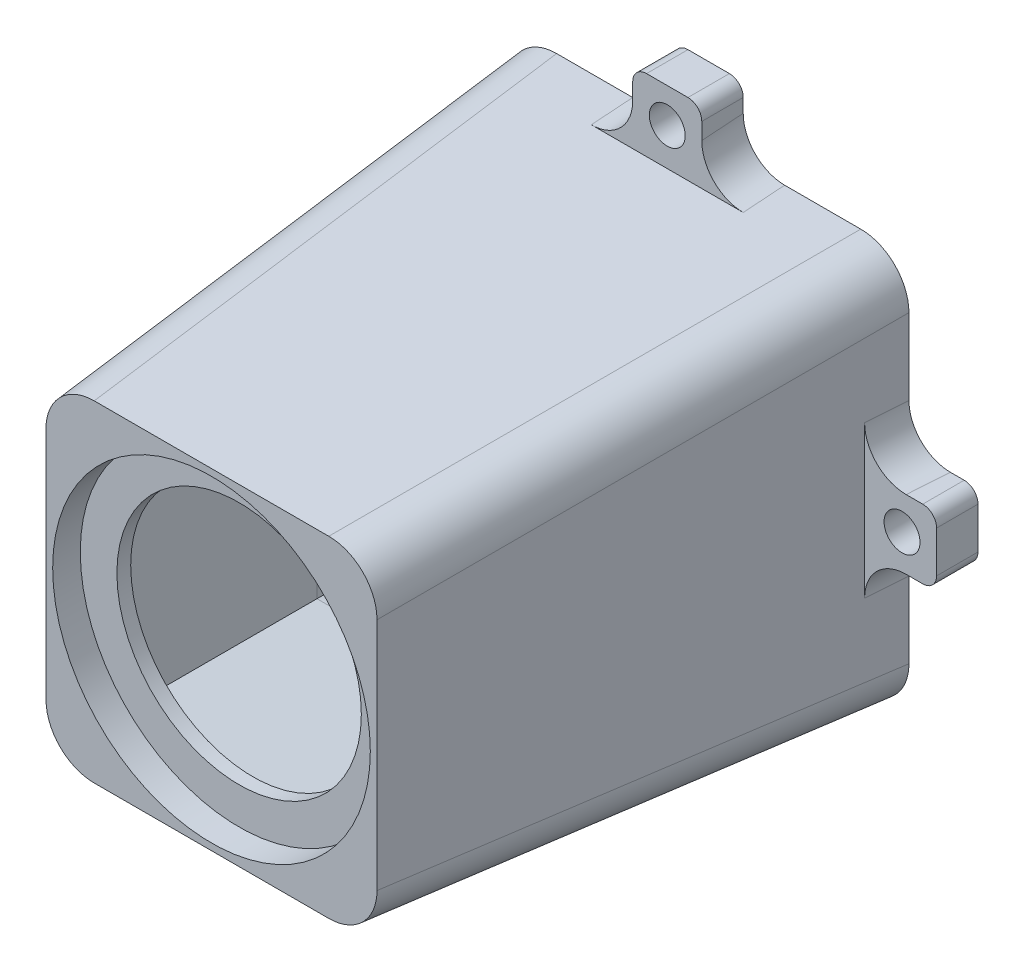
from build123d import *

# Parameters (mm, degrees)
SKETCH_1_W          = 29
SKETCH_1_H          = 29
EXTRUDE_1_DEPTH     = 36
EXTRUDE_1_TAPER     = 4
SHELL_1_T           = -3
SKETCH_3_W          = 22.3
SKETCH_3_H          = 22.3
CUT_EXTRUDE_2_DEPTH = 16
FILLET_1_R          = 3.5
FILLET_2_R          = 3.5
SKETCH_4_R          = 8.85
CUT_EXTRUDE_3_DEPTH = 3
SKETCH_5_R          = 11.5
CUT_EXTRUDE_4_DEPTH = 2
SKETCH_6_W          = 6.3
SKETCH_6_H          = 5
SKETCH_6_R          = 1.3
SKETCH_6_W_2        = 5
SKETCH_6_H_2        = 6.3
EXTRUDE_2_DEPTH     = 3
FILLET_3_R          = 3
FILLET_4_R          = 1


with BuildPart() as part:
    # Эскиз1 → Бобышка-Вытянуть1 (new body)
    with BuildSketch(Plane.XY):
        Rectangle(SKETCH_1_W, SKETCH_1_H)
    extrude(amount=EXTRUDE_1_DEPTH, taper=EXTRUDE_1_TAPER)

    # Оболочка1
    shell_1_openings = [part.faces().sort_by_distance(p)[0] for p in [
        (0, 0, 0),
    ]]
    offset(amount=SHELL_1_T, openings=shell_1_openings, kind=Kind.INTERSECTION)

    # Эскиз3 → Вырез-Вытянуть2 (cut)
    with BuildSketch(Plane(origin=(0, 0, 0), x_dir=(-1, 0, 0), z_dir=(0, 0, -1))):
        Rectangle(SKETCH_3_W, SKETCH_3_H)
    extrude(amount=-CUT_EXTRUDE_2_DEPTH, mode=Mode.SUBTRACT)

    # Скругление1
    # the kernel refuses this fillet: 3.5 mm, written as the material it takes off along each edge
    with BuildSketch(Plane(origin=(-10.373845315, -15.727322236, 16), x_dir=(-1, 0, 0), z_dir=(0, 1, 0))) as fillet_1_piece_1_section:
        with BuildLine():
            CenterArc((3.342098307, 2.380322106), FILLET_1_R, 184, 38.850835044)
            Line((-0.149375869, 2.136174448), (0, 0))
            Line((0, 0), (0.776154685, 0))
        make_face()
    fillet_1_piece_1 = extrude(amount=31.454644473, mode=Mode.PRIVATE)
    fillet_1_piece_1 = split(fillet_1_piece_1, bisect_by=Plane(origin=(-10.373845315, -10.399895149, 15.627470008), z_dir=(0, 0.9975640502598243, -0.06975647374412536)), keep=Keep.TOP, mode=Mode.PRIVATE)
    fillet_1_piece_1 = split(fillet_1_piece_1, bisect_by=Plane(origin=(-10.373845315, 10.24683793, 17.816290213), z_dir=(0, -0.9975640502598243, -0.06975647374412536)), keep=Keep.TOP, mode=Mode.PRIVATE)
    add(fillet_1_piece_1, mode=Mode.SUBTRACT)
    with BuildSketch(Plane(origin=(15.727322236, -10.373845315, 16), x_dir=(0, -1, 0), z_dir=(-1, 0, 0))) as fillet_1_piece_2_section:
        with BuildLine():
            CenterArc((3.342098307, 2.380322106), FILLET_1_R, 184, 38.850835044)
            Line((-0.149375869, 2.136174448), (0, 0))
            Line((0, 0), (0.776154685, 0))
        make_face()
    fillet_1_piece_2 = extrude(amount=31.454644473, mode=Mode.PRIVATE)
    fillet_1_piece_2 = split(fillet_1_piece_2, bisect_by=Plane(origin=(-10.24683793, -10.373845315, 17.816290213), z_dir=(0.9975640502598243, 0, -0.06975647374412536)), keep=Keep.TOP, mode=Mode.PRIVATE)
    fillet_1_piece_2 = split(fillet_1_piece_2, bisect_by=Plane(origin=(10.399895149, -10.373845315, 15.627470008), z_dir=(-0.9975640502598243, 0, -0.06975647374412536)), keep=Keep.TOP, mode=Mode.PRIVATE)
    add(fillet_1_piece_2, mode=Mode.SUBTRACT)
    with BuildSketch(Plane(origin=(10.373845315, 15.727322236, 16), x_dir=(1, 0, 0), z_dir=(0, -1, 0))) as fillet_1_piece_3_section:
        with BuildLine():
            CenterArc((3.342098307, 2.380322106), FILLET_1_R, 184, 38.850835044)
            Line((-0.149375869, 2.136174448), (0, 0))
            Line((0, 0), (0.776154685, 0))
        make_face()
    fillet_1_piece_3 = extrude(amount=31.454644473, mode=Mode.PRIVATE)
    fillet_1_piece_3 = split(fillet_1_piece_3, bisect_by=Plane(origin=(10.373845315, -10.24683793, 17.816290213), z_dir=(0, 0.9975640502598243, -0.06975647374412536)), keep=Keep.TOP, mode=Mode.PRIVATE)
    fillet_1_piece_3 = split(fillet_1_piece_3, bisect_by=Plane(origin=(10.373845315, 10.399895149, 15.627470008), z_dir=(0, -0.9975640502598243, -0.06975647374412536)), keep=Keep.TOP, mode=Mode.PRIVATE)
    add(fillet_1_piece_3, mode=Mode.SUBTRACT)
    with BuildSketch(Plane(origin=(-15.727322236, 10.373845315, 16), x_dir=(0, 1, 0), z_dir=(1, 0, 0))) as fillet_1_piece_4_section:
        with BuildLine():
            CenterArc((3.342098307, 2.380322106), FILLET_1_R, 184, 38.850835044)
            Line((-0.149375869, 2.136174448), (0, 0))
            Line((0, 0), (0.776154685, 0))
        make_face()
    fillet_1_piece_4 = extrude(amount=31.454644473, mode=Mode.PRIVATE)
    fillet_1_piece_4 = split(fillet_1_piece_4, bisect_by=Plane(origin=(-10.399895149, 10.373845315, 15.627470008), z_dir=(0.9975640502598243, 0, -0.06975647374412536)), keep=Keep.TOP, mode=Mode.PRIVATE)
    fillet_1_piece_4 = split(fillet_1_piece_4, bisect_by=Plane(origin=(10.24683793, 10.373845315, 17.816290213), z_dir=(-0.9975640502598243, 0, -0.06975647374412536)), keep=Keep.TOP, mode=Mode.PRIVATE)
    add(fillet_1_piece_4, mode=Mode.SUBTRACT)
    with BuildSketch(Plane(origin=(15.727322236, -10.373845315, 16), x_dir=(0, -1, 0), z_dir=(-1, 0, 0))) as fillet_1_piece_5a_section:
        with BuildLine():
            CenterArc((3.342098307, 2.380322106), FILLET_1_R, 184, 38.850835044)
            Line((-0.149375869, 2.136174448), (0, 0))
            Line((0, 0), (0.776154685, 0))
        make_face()
    fillet_1_piece_5a = extrude(amount=31.454644473, mode=Mode.PRIVATE)
    fillet_1_piece_5a = split(fillet_1_piece_5a, bisect_by=Plane(origin=(-11.15, -10.373845315, 16), z_dir=(1, 0, 0)), keep=Keep.TOP, mode=Mode.PRIVATE)
    fillet_1_piece_5a = split(fillet_1_piece_5a, bisect_by=Plane(origin=(-10.24683793, -10.373845315, 17.816290213), z_dir=(-0.9975640502598243, 0, 0.06975647374412536)), keep=Keep.TOP, mode=Mode.PRIVATE)
    with BuildSketch(Plane(origin=(-10.373845315, -15.727322236, 16), x_dir=(-1, 0, 0), z_dir=(0, 1, 0))) as fillet_1_piece_5b_section:
        with BuildLine():
            CenterArc((3.342098307, 2.380322106), FILLET_1_R, 184, 38.850835044)
            Line((-0.149375869, 2.136174448), (0, 0))
            Line((0, 0), (0.776154685, 0))
        make_face()
    fillet_1_piece_5b = extrude(amount=31.454644473, mode=Mode.PRIVATE)
    fillet_1_piece_5b = split(fillet_1_piece_5b, bisect_by=Plane(origin=(-10.373845315, -11.15, 16), z_dir=(0, 1, 0)), keep=Keep.TOP, mode=Mode.PRIVATE)
    fillet_1_piece_5b = split(fillet_1_piece_5b, bisect_by=Plane(origin=(-10.373845315, -10.399895149, 15.627470008), z_dir=(0, -0.9975640502598243, 0.06975647374412536)), keep=Keep.TOP, mode=Mode.PRIVATE)
    fillet_1_piece_5 = fillet_1_piece_5a & fillet_1_piece_5b
    add(fillet_1_piece_5, mode=Mode.SUBTRACT)
    with BuildSketch(Plane(origin=(-10.373845315, -15.727322236, 16), x_dir=(-1, 0, 0), z_dir=(0, 1, 0))) as fillet_1_piece_6a_section:
        with BuildLine():
            CenterArc((3.342098307, 2.380322106), FILLET_1_R, 184, 38.850835044)
            Line((-0.149375869, 2.136174448), (0, 0))
            Line((0, 0), (0.776154685, 0))
        make_face()
    fillet_1_piece_6a = extrude(amount=31.454644473, mode=Mode.PRIVATE)
    fillet_1_piece_6a = split(fillet_1_piece_6a, bisect_by=Plane(origin=(-10.373845315, 11.15, 16), z_dir=(0, -1, 0)), keep=Keep.TOP, mode=Mode.PRIVATE)
    fillet_1_piece_6a = split(fillet_1_piece_6a, bisect_by=Plane(origin=(-10.373845315, 10.24683793, 17.816290213), z_dir=(0, 0.9975640502598243, 0.06975647374412536)), keep=Keep.TOP, mode=Mode.PRIVATE)
    with BuildSketch(Plane(origin=(-15.727322236, 10.373845315, 16), x_dir=(0, 1, 0), z_dir=(1, 0, 0))) as fillet_1_piece_6b_section:
        with BuildLine():
            CenterArc((3.342098307, 2.380322106), FILLET_1_R, 184, 38.850835044)
            Line((-0.149375869, 2.136174448), (0, 0))
            Line((0, 0), (0.776154685, 0))
        make_face()
    fillet_1_piece_6b = extrude(amount=31.454644473, mode=Mode.PRIVATE)
    fillet_1_piece_6b = split(fillet_1_piece_6b, bisect_by=Plane(origin=(-11.15, 10.373845315, 16), z_dir=(1, 0, 0)), keep=Keep.TOP, mode=Mode.PRIVATE)
    fillet_1_piece_6b = split(fillet_1_piece_6b, bisect_by=Plane(origin=(-10.399895149, 10.373845315, 15.627470008), z_dir=(-0.9975640502598243, 0, 0.06975647374412536)), keep=Keep.TOP, mode=Mode.PRIVATE)
    fillet_1_piece_6 = fillet_1_piece_6a & fillet_1_piece_6b
    add(fillet_1_piece_6, mode=Mode.SUBTRACT)
    with BuildSketch(Plane(origin=(15.727322236, -10.373845315, 16), x_dir=(0, -1, 0), z_dir=(-1, 0, 0))) as fillet_1_piece_7a_section:
        with BuildLine():
            CenterArc((3.342098307, 2.380322106), FILLET_1_R, 184, 38.850835044)
            Line((-0.149375869, 2.136174448), (0, 0))
            Line((0, 0), (0.776154685, 0))
        make_face()
    fillet_1_piece_7a = extrude(amount=31.454644473, mode=Mode.PRIVATE)
    fillet_1_piece_7a = split(fillet_1_piece_7a, bisect_by=Plane(origin=(11.15, -10.373845315, 16), z_dir=(-1, 0, 0)), keep=Keep.TOP, mode=Mode.PRIVATE)
    fillet_1_piece_7a = split(fillet_1_piece_7a, bisect_by=Plane(origin=(10.399895149, -10.373845315, 15.627470008), z_dir=(0.9975640502598243, 0, 0.06975647374412536)), keep=Keep.TOP, mode=Mode.PRIVATE)
    with BuildSketch(Plane(origin=(10.373845315, 15.727322236, 16), x_dir=(1, 0, 0), z_dir=(0, -1, 0))) as fillet_1_piece_7b_section:
        with BuildLine():
            CenterArc((3.342098307, 2.380322106), FILLET_1_R, 184, 38.850835044)
            Line((-0.149375869, 2.136174448), (0, 0))
            Line((0, 0), (0.776154685, 0))
        make_face()
    fillet_1_piece_7b = extrude(amount=31.454644473, mode=Mode.PRIVATE)
    fillet_1_piece_7b = split(fillet_1_piece_7b, bisect_by=Plane(origin=(10.373845315, -11.15, 16), z_dir=(0, 1, 0)), keep=Keep.TOP, mode=Mode.PRIVATE)
    fillet_1_piece_7b = split(fillet_1_piece_7b, bisect_by=Plane(origin=(10.373845315, -10.24683793, 17.816290213), z_dir=(0, -0.9975640502598243, 0.06975647374412536)), keep=Keep.TOP, mode=Mode.PRIVATE)
    fillet_1_piece_7 = fillet_1_piece_7a & fillet_1_piece_7b
    add(fillet_1_piece_7, mode=Mode.SUBTRACT)
    with BuildSketch(Plane(origin=(-15.727322236, 10.373845315, 16), x_dir=(0, 1, 0), z_dir=(1, 0, 0))) as fillet_1_piece_8a_section:
        with BuildLine():
            CenterArc((3.342098307, 2.380322106), FILLET_1_R, 184, 38.850835044)
            Line((-0.149375869, 2.136174448), (0, 0))
            Line((0, 0), (0.776154685, 0))
        make_face()
    fillet_1_piece_8a = extrude(amount=31.454644473, mode=Mode.PRIVATE)
    fillet_1_piece_8a = split(fillet_1_piece_8a, bisect_by=Plane(origin=(11.15, 10.373845315, 16), z_dir=(-1, 0, 0)), keep=Keep.TOP, mode=Mode.PRIVATE)
    fillet_1_piece_8a = split(fillet_1_piece_8a, bisect_by=Plane(origin=(10.24683793, 10.373845315, 17.816290213), z_dir=(0.9975640502598243, 0, 0.06975647374412536)), keep=Keep.TOP, mode=Mode.PRIVATE)
    with BuildSketch(Plane(origin=(10.373845315, 15.727322236, 16), x_dir=(1, 0, 0), z_dir=(0, -1, 0))) as fillet_1_piece_8b_section:
        with BuildLine():
            CenterArc((3.342098307, 2.380322106), FILLET_1_R, 184, 38.850835044)
            Line((-0.149375869, 2.136174448), (0, 0))
            Line((0, 0), (0.776154685, 0))
        make_face()
    fillet_1_piece_8b = extrude(amount=31.454644473, mode=Mode.PRIVATE)
    fillet_1_piece_8b = split(fillet_1_piece_8b, bisect_by=Plane(origin=(10.373845315, 11.15, 16), z_dir=(0, -1, 0)), keep=Keep.TOP, mode=Mode.PRIVATE)
    fillet_1_piece_8b = split(fillet_1_piece_8b, bisect_by=Plane(origin=(10.373845315, 10.399895149, 15.627470008), z_dir=(0, 0.9975640502598243, 0.06975647374412536)), keep=Keep.TOP, mode=Mode.PRIVATE)
    fillet_1_piece_8 = fillet_1_piece_8a & fillet_1_piece_8b
    add(fillet_1_piece_8, mode=Mode.SUBTRACT)

    # Скругление2
    fillet_2_edges = [part.edges().sort_by_distance(p)[0] for p in [
        (-13.241317385, -13.241317385, 18),
        (-13.241317385, 13.241317385, 18),
        (13.241316923, 13.241316923, 18.000006606),
        (13.241317385, -13.241317385, 18),
    ]]
    fillet(fillet_2_edges, radius=FILLET_2_R)

    # Эскиз4 → Вырез-Вытянуть3 (cut)
    with BuildSketch(Plane.XY.offset(36)):
        Circle(SKETCH_4_R)
    extrude(amount=-CUT_EXTRUDE_3_DEPTH, mode=Mode.SUBTRACT)

    # Эскиз5 → Вырез-Вытянуть4 (cut)
    with BuildSketch(Plane.XY.offset(36)):
        Circle(SKETCH_5_R)
    extrude(amount=-CUT_EXTRUDE_4_DEPTH, mode=Mode.SUBTRACT)

    # Эскиз6 → Бобышка-Вытянуть2 (add)
    # profile 1 of 4: a face of its own
    with BuildSketch(Plane(origin=(0, 0, 0), x_dir=(-1, 0, 0), z_dir=(0, 0, -1))):
        with Locations((16.35, 0)):
            Rectangle(SKETCH_6_W, SKETCH_6_H)
        with Locations((17, 0)):
            Circle(SKETCH_6_R, mode=Mode.SUBTRACT)
    # profile 2 of 4: a face of its own
    with BuildSketch(Plane(origin=(0, 0, 0), x_dir=(-1, 0, 0), z_dir=(0, 0, -1))):
        with Locations((0, -16.35)):
            Rectangle(SKETCH_6_W_2, SKETCH_6_H_2)
        with Locations((0, -17)):
            Circle(SKETCH_6_R, mode=Mode.SUBTRACT)
    # profile 3 of 4: a face of its own
    with BuildSketch(Plane(origin=(0, 0, 0), x_dir=(-1, 0, 0), z_dir=(0, 0, -1))):
        with Locations((-16.35, 0)):
            Rectangle(SKETCH_6_W, SKETCH_6_H)
        with Locations((-17, 0)):
            Circle(SKETCH_6_R, mode=Mode.SUBTRACT)
    # profile 4 of 4: a face of its own
    with BuildSketch(Plane(origin=(0, 0, 0), x_dir=(-1, 0, 0), z_dir=(0, 0, -1))):
        with Locations((0, 16.35)):
            Rectangle(SKETCH_6_W_2, SKETCH_6_H_2)
        with Locations((0, 17)):
            Circle(SKETCH_6_R, mode=Mode.SUBTRACT)
    extrude(amount=-EXTRUDE_2_DEPTH)

    # Скругление3
    fillet_3_edges = [part.edges().sort_by_distance(p)[0] for p in [
        (-14.395109782, -2.5, 1.5),
        (-14.395109782, 2.5, 1.5),
        (-2.5, -14.395109782, 1.5),
        (2.5, -14.395109782, 1.5),
        (14.395109782, -2.5, 1.5),
        (14.395109782, 2.5, 1.5),
        (2.5, 14.395109782, 1.5),
        (-2.5, 14.395109782, 1.5),
    ]]
    fillet(fillet_3_edges, radius=FILLET_3_R)

    # Скругление4
    fillet_4_edges = [part.edges().sort_by_distance(p)[0] for p in [
        (-19.5, -2.5, 1.5),
        (-19.5, 2.5, 1.5),
        (2.5, -19.5, 1.5),
        (-2.5, -19.5, 1.5),
        (19.5, 2.5, 1.5),
        (19.5, -2.5, 1.5),
        (-2.5, 19.5, 1.5),
        (2.5, 19.5, 1.5),
    ]]
    fillet(fillet_4_edges, radius=FILLET_4_R)


solid = part.part
